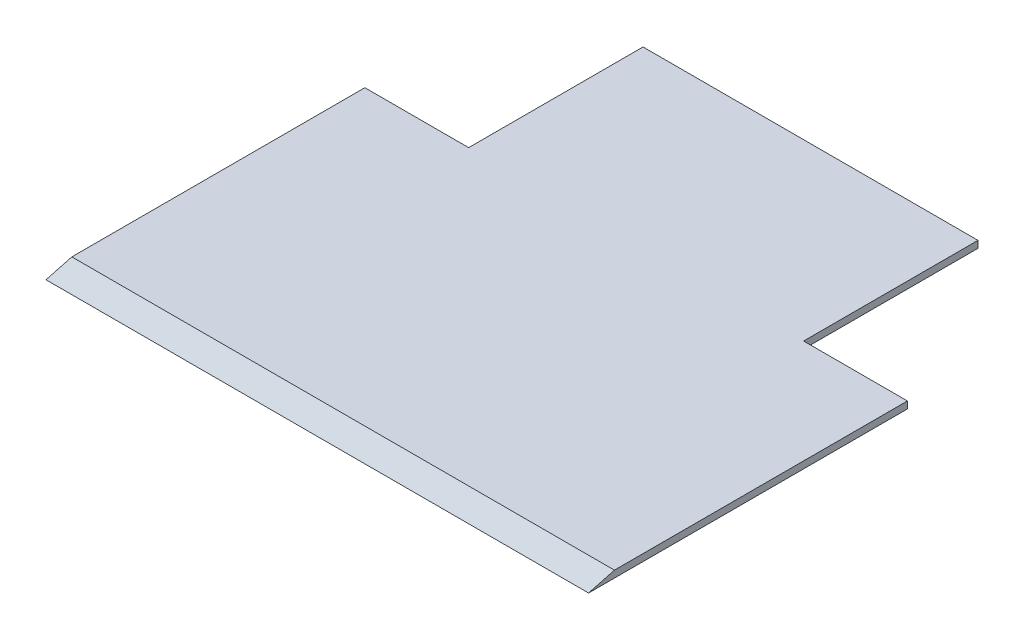
from build123d import *

# Parameters (mm, degrees)
SALIENTE_EXTRUIR1_DEPTH = 196
CORTAR_EXTRUIR1_REACH   = 266.89
CROQUIS2_W              = 37.5
CROQUIS2_H              = 62.989872981


with BuildPart() as part:
    # Croquis1 → Saliente-Extruir1 (new body)
    with BuildSketch(Plane(origin=(0, 0, 0), x_dir=(0, 0, -1), z_dir=(1, 0, 0))):
        Polygon((0, 0), (178.17, 0), (178.17, 2.5), (9.330127019, 2.5), align=None)
    extrude(amount=SALIENTE_EXTRUIR1_DEPTH)

    # Croquis2 → Cortar-Extruir1 (cut, up to next)
    with BuildSketch(Plane(origin=(0, 0, 0), x_dir=(-1, 0, 0), z_dir=(0, -1, 0)), mode=Mode.PRIVATE) as cortar_extruir1_sk1:
        with Locations((-18.75, 146.67506351)):
            Rectangle(CROQUIS2_W, CROQUIS2_H)
    cortar_extruir1_tool1 = extrude(cortar_extruir1_sk1.sketch, amount=-CORTAR_EXTRUIR1_REACH, mode=Mode.PRIVATE) & part.part
    # Croquis2 → Cortar-Extruir1 (cut, up to next)
    with BuildSketch(Plane(origin=(0, 0, 0), x_dir=(-1, 0, 0), z_dir=(0, -1, 0)), mode=Mode.PRIVATE) as cortar_extruir1_sk2:
        with Locations((-177.25, 146.67506351)):
            Rectangle(CROQUIS2_W, CROQUIS2_H)
    cortar_extruir1_tool2 = extrude(cortar_extruir1_sk2.sketch, amount=-CORTAR_EXTRUIR1_REACH, mode=Mode.PRIVATE) & part.part
    add(cortar_extruir1_tool1.solids().sort_by_distance((18.75, 0, -146.675064))[0], mode=Mode.SUBTRACT)
    add(cortar_extruir1_tool2.solids().sort_by_distance((177.25, 0, -146.675064))[0], mode=Mode.SUBTRACT)


solid = part.part
